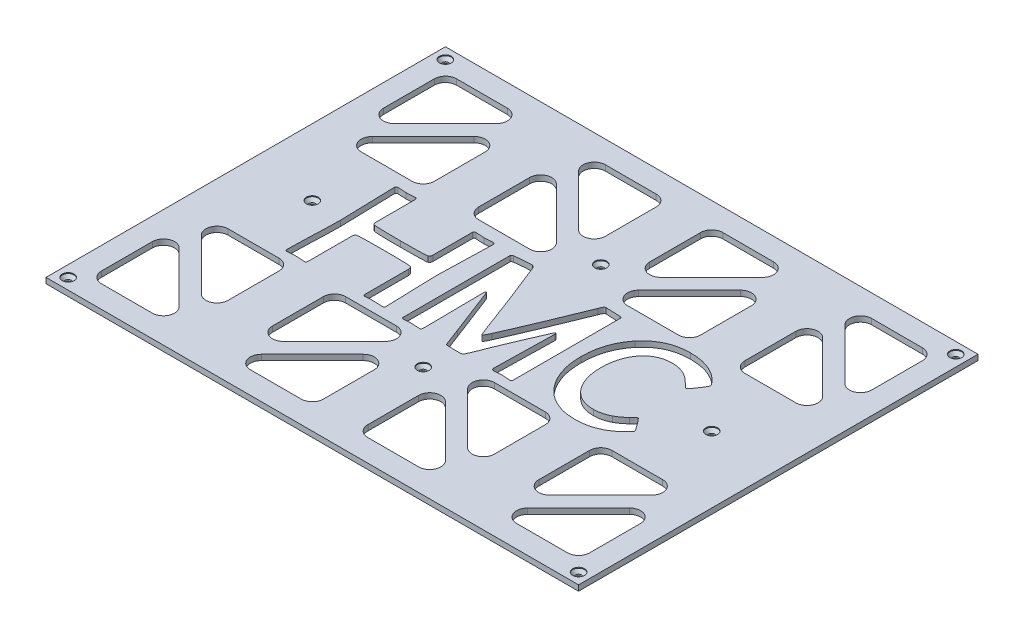
from build123d import *

# Parameters (mm, degrees)
SKETCH2_W                                    = 609.6
SKETCH2_H                                    = 457.2
BOSS_EXTRUDE1_DEPTH                          = 6.35
CSK_FOR_1_4_FLAT_HEAD_SOCKET_CAP_SCR_2_COUNT = 2
CSK_FOR_1_4_FLAT_HEAD_SOCKET_CAP_SCR_2_PITCH = 225.044573363
CSK_FOR_1_4_FLAT_HEAD_SOCKET_CAP_SCR_3_COUNT = 2
CSK_FOR_1_4_FLAT_HEAD_SOCKET_CAP_SCR_3_PITCH = 431.8
CSK_FOR_1_4_FLAT_HEAD_SOCKET_CAP_SCR_4_COUNT = 2
CSK_FOR_1_4_FLAT_HEAD_SOCKET_CAP_SCR_4_PITCH = 431.426308887
CSK_FOR_1_4_FLAT_HEAD_SOCKET_CAP_SCR_5_COUNT = 2
CSK_FOR_1_4_FLAT_HEAD_SOCKET_CAP_SCR_5_PITCH = 313.666861495
CSK_FOR_1_4_FLAT_HEAD_SOCKET_CAP_SCR_6_COUNT = 2
CSK_FOR_1_4_FLAT_HEAD_SOCKET_CAP_SCR_6_PITCH = 584.2
CSK_FOR_1_4_FLAT_HEAD_SOCKET_CAP_SCR_7_COUNT = 2
CSK_FOR_1_4_FLAT_HEAD_SOCKET_CAP_SCR_7_PITCH = 563.685461938
CSK_FOR_1_4_FLAT_HEAD_SOCKET_CAP_SCR_8_COUNT = 2
CSK_FOR_1_4_FLAT_HEAD_SOCKET_CAP_SCR_8_PITCH = 726.457762021


with BuildPart() as part:
    # Sketch2 → Boss-Extrude1 (new body)
    with BuildSketch(Plane(origin=(0, 0, 0), x_dir=(1, 0, 0), z_dir=(0, 1, 0))):
        with Locations((39.071311338, -112.036262161)):
            Rectangle(SKETCH2_W, SKETCH2_H)
        with BuildLine():
            Line((-240.328688662, 78.463737839), (-240.328688662, 20.224250081))
            ThreePointArc((-240.328688662, 20.224250081), (-232.488768253, 8.490980019), (-218.648432541, 11.24399396))
            Line((-218.648432541, 11.24399396), (-160.408944783, 69.483481718))
            ThreePointArc((-160.408944783, 69.483481718), (-157.655930841, 83.32381743), (-169.389200904, 91.163737839))
            Line((-169.389200904, 91.163737839), (-227.628688662, 91.163737839))
            ThreePointArc((-227.628688662, 91.163737839), (-236.608944783, 87.44399396), (-240.328688662, 78.463737839))
        make_face(mode=Mode.SUBTRACT)
        with BuildLine():
            Line((-218.648432541, -14.15600604), (-160.408944783, 44.083481718))
            ThreePointArc((-160.408944783, 44.083481718), (-146.568609071, 46.83649566), (-138.728688662, 35.103225597))
            Line((-138.728688662, 35.103225597), (-138.728688662, -23.136262161))
            ThreePointArc((-138.728688662, -23.136262161), (-142.448432541, -32.116518282), (-151.428688662, -35.836262161))
            Line((-151.428688662, -35.836262161), (-209.668176419, -35.836262161))
            ThreePointArc((-209.668176419, -35.836262161), (-221.401446482, -27.996341752), (-218.648432541, -14.15600604))
        make_face(mode=Mode.SUBTRACT)
        with BuildLine():
            Line((-75.228688662, -35.836262161), (-16.989200904, -35.836262161))
            ThreePointArc((-16.989200904, -35.836262161), (-5.255930841, -27.996341752), (-8.008944783, -14.15600604))
            Line((-8.008944783, -14.15600604), (-66.248432541, 44.083481718))
            ThreePointArc((-66.248432541, 44.083481718), (-80.088768253, 46.83649566), (-87.928688662, 35.103225597))
            Line((-87.928688662, 35.103225597), (-87.928688662, -23.136262161))
            ThreePointArc((-87.928688662, -23.136262161), (-84.208944783, -32.116518282), (-75.228688662, -35.836262161))
        make_face(mode=Mode.SUBTRACT)
        with BuildLine():
            Line((-57.268176419, 91.163737839), (0.971311338, 91.163737839))
            ThreePointArc((0.971311338, 91.163737839), (9.951567459, 87.44399396), (13.671311338, 78.463737839))
            Line((13.671311338, 78.463737839), (13.671311338, 20.224250081))
            ThreePointArc((13.671311338, 20.224250081), (5.831390929, 8.490980019), (-8.008944783, 11.24399396))
            Line((-8.008944783, 11.24399396), (-66.248432541, 69.483481718))
            ThreePointArc((-66.248432541, 69.483481718), (-69.001446482, 83.32381743), (-57.268176419, 91.163737839))
        make_face(mode=Mode.SUBTRACT)
        with BuildLine():
            Line((64.471311338, 78.463737839), (64.471311338, 20.224250081))
            ThreePointArc((64.471311338, 20.224250081), (72.311231747, 8.490980019), (86.151567459, 11.24399396))
            Line((86.151567459, 11.24399396), (144.391055217, 69.483481718))
            ThreePointArc((144.391055217, 69.483481718), (147.144069159, 83.32381743), (135.410799096, 91.163737839))
            Line((135.410799096, 91.163737839), (77.171311338, 91.163737839))
            ThreePointArc((77.171311338, 91.163737839), (68.191055217, 87.44399396), (64.471311338, 78.463737839))
        make_face(mode=Mode.SUBTRACT)
        with BuildLine():
            Line((86.151567459, -14.15600604), (144.391055217, 44.083481718))
            ThreePointArc((144.391055217, 44.083481718), (158.231390929, 46.83649566), (166.071311338, 35.103225597))
            Line((166.071311338, 35.103225597), (166.071311338, -23.136262161))
            ThreePointArc((166.071311338, -23.136262161), (162.351567459, -32.116518282), (153.371311338, -35.836262161))
            Line((153.371311338, -35.836262161), (95.131823581, -35.836262161))
            ThreePointArc((95.131823581, -35.836262161), (83.398553518, -27.996341752), (86.151567459, -14.15600604))
        make_face(mode=Mode.SUBTRACT)
        with BuildLine():
            Line((229.571311338, -35.836262161), (287.810799096, -35.836262161))
            ThreePointArc((287.810799096, -35.836262161), (299.544069159, -27.996341752), (296.791055217, -14.15600604))
            Line((296.791055217, -14.15600604), (238.551567459, 44.083481718))
            ThreePointArc((238.551567459, 44.083481718), (224.711231747, 46.83649566), (216.871311338, 35.103225597))
            Line((216.871311338, 35.103225597), (216.871311338, -23.136262161))
            ThreePointArc((216.871311338, -23.136262161), (220.591055217, -32.116518282), (229.571311338, -35.836262161))
        make_face(mode=Mode.SUBTRACT)
        with BuildLine():
            Line((247.531823581, 91.163737839), (305.771311338, 91.163737839))
            ThreePointArc((305.771311338, 91.163737839), (314.751567459, 87.44399396), (318.471311338, 78.463737839))
            Line((318.471311338, 78.463737839), (318.471311338, 20.224250081))
            ThreePointArc((318.471311338, 20.224250081), (310.631390929, 8.490980019), (296.791055217, 11.24399396))
            Line((296.791055217, 11.24399396), (238.551567459, 69.483481718))
            ThreePointArc((238.551567459, 69.483481718), (235.798553518, 83.32381743), (247.531823581, 91.163737839))
        make_face(mode=Mode.SUBTRACT)
        with BuildLine():
            Line((318.471311338, -302.536262161), (318.471311338, -244.296774403))
            ThreePointArc((318.471311338, -244.296774403), (310.631390929, -232.56350434), (296.791055217, -235.316518282))
            Line((296.791055217, -235.316518282), (238.551567459, -293.55600604))
            ThreePointArc((238.551567459, -293.55600604), (235.798553518, -307.396341752), (247.531823581, -315.236262161))
            Line((247.531823581, -315.236262161), (305.771311338, -315.236262161))
            ThreePointArc((305.771311338, -315.236262161), (314.751567459, -311.516518282), (318.471311338, -302.536262161))
        make_face(mode=Mode.SUBTRACT)
        with BuildLine():
            Line((296.791055217, -209.916518282), (238.551567459, -268.15600604))
            ThreePointArc((238.551567459, -268.15600604), (224.711231747, -270.909019981), (216.871311338, -259.175749919))
            Line((216.871311338, -259.175749919), (216.871311338, -200.936262161))
            ThreePointArc((216.871311338, -200.936262161), (220.591055217, -191.95600604), (229.571311338, -188.236262161))
            Line((229.571311338, -188.236262161), (287.810799096, -188.236262161))
            ThreePointArc((287.810799096, -188.236262161), (299.544069159, -196.07618257), (296.791055217, -209.916518282))
        make_face(mode=Mode.SUBTRACT)
        with BuildLine():
            Line((153.371311338, -188.236262161), (95.131823581, -188.236262161))
            ThreePointArc((95.131823581, -188.236262161), (83.398553518, -196.07618257), (86.151567459, -209.916518282))
            Line((86.151567459, -209.916518282), (144.391055217, -268.15600604))
            ThreePointArc((144.391055217, -268.15600604), (158.231390929, -270.909019981), (166.071311338, -259.175749919))
            Line((166.071311338, -259.175749919), (166.071311338, -200.936262161))
            ThreePointArc((166.071311338, -200.936262161), (162.351567459, -191.95600604), (153.371311338, -188.236262161))
        make_face(mode=Mode.SUBTRACT)
        with BuildLine():
            Line((135.410799096, -315.236262161), (77.171311338, -315.236262161))
            ThreePointArc((77.171311338, -315.236262161), (68.191055217, -311.516518282), (64.471311338, -302.536262161))
            Line((64.471311338, -302.536262161), (64.471311338, -244.296774403))
            ThreePointArc((64.471311338, -244.296774403), (72.311231747, -232.56350434), (86.151567459, -235.316518282))
            Line((86.151567459, -235.316518282), (144.391055217, -293.55600604))
            ThreePointArc((144.391055217, -293.55600604), (147.144069159, -307.396341752), (135.410799096, -315.236262161))
        make_face(mode=Mode.SUBTRACT)
        with BuildLine():
            Line((13.671311338, -302.536262161), (13.671311338, -244.296774403))
            ThreePointArc((13.671311338, -244.296774403), (5.831390929, -232.56350434), (-8.008944783, -235.316518282))
            Line((-8.008944783, -235.316518282), (-66.248432541, -293.55600604))
            ThreePointArc((-66.248432541, -293.55600604), (-69.001446482, -307.396341752), (-57.268176419, -315.236262161))
            Line((-57.268176419, -315.236262161), (0.971311338, -315.236262161))
            ThreePointArc((0.971311338, -315.236262161), (9.951567459, -311.516518282), (13.671311338, -302.536262161))
        make_face(mode=Mode.SUBTRACT)
        with BuildLine():
            Line((-8.008944783, -209.916518282), (-66.248432541, -268.15600604))
            ThreePointArc((-66.248432541, -268.15600604), (-80.088768253, -270.909019981), (-87.928688662, -259.175749919))
            Line((-87.928688662, -259.175749919), (-87.928688662, -200.936262161))
            ThreePointArc((-87.928688662, -200.936262161), (-84.208944783, -191.95600604), (-75.228688662, -188.236262161))
            Line((-75.228688662, -188.236262161), (-16.989200904, -188.236262161))
            ThreePointArc((-16.989200904, -188.236262161), (-5.255930841, -196.07618257), (-8.008944783, -209.916518282))
        make_face(mode=Mode.SUBTRACT)
        with BuildLine():
            Line((-151.428688662, -188.236262161), (-209.668176419, -188.236262161))
            ThreePointArc((-209.668176419, -188.236262161), (-221.401446482, -196.07618257), (-218.648432541, -209.916518282))
            Line((-218.648432541, -209.916518282), (-160.408944783, -268.15600604))
            ThreePointArc((-160.408944783, -268.15600604), (-146.568609071, -270.909019981), (-138.728688662, -259.175749919))
            Line((-138.728688662, -259.175749919), (-138.728688662, -200.936262161))
            ThreePointArc((-138.728688662, -200.936262161), (-142.448432541, -191.95600604), (-151.428688662, -188.236262161))
        make_face(mode=Mode.SUBTRACT)
        with BuildLine():
            Line((-169.389200904, -315.236262161), (-227.628688662, -315.236262161))
            ThreePointArc((-227.628688662, -315.236262161), (-236.608944783, -311.516518282), (-240.328688662, -302.536262161))
            Line((-240.328688662, -302.536262161), (-240.328688662, -244.296774403))
            ThreePointArc((-240.328688662, -244.296774403), (-232.488768253, -232.56350434), (-218.648432541, -235.316518282))
            Line((-218.648432541, -235.316518282), (-160.408944783, -293.55600604))
            ThreePointArc((-160.408944783, -293.55600604), (-157.655930841, -307.396341752), (-169.389200904, -315.236262161))
        make_face(mode=Mode.SUBTRACT)
        with BuildLine():
            add(Edge.make_bspline(
                [(-42.347338313, -174.953657716), (-42.369691549, -175.267395974), (-42.41146811, -175.853749772), (-42.978228428, -176.595151068), (-43.889123051, -176.994018749), (-44.586756035, -177.026953573), (-44.975294394, -177.045296229)],
                knots=[0, 0, 0, 0, 0.97081256, 1.814377484, 2.782743641, 4, 4, 4, 4], degree=3))
            add(Edge.make_bspline(
                [(-44.975294394, -177.045296229), (-45.261377324, -177.037554922), (-45.896411647, -177.02037111), (-46.951127367, -176.96237211), (-48.20259125, -176.881843445), (-50.017298845, -176.751153708), (-52.05975743, -176.543320116), (-53.627469743, -176.519076044), (-54.280404191, -176.508978662)],
                knots=[0, 0, 0, 0, 0.552547447, 1.226520551, 2.039329384, 2.973851592, 4.739643413, 6, 6, 6, 6], degree=3))
            add(Edge.make_bspline(
                [(-54.280404191, -176.508978662), (-54.593190525, -176.519382085), (-55.290204318, -176.542565098), (-56.445823206, -176.544819155), (-57.810054334, -176.687435931), (-59.322058518, -176.772652883), (-60.831909837, -176.883522238), (-62.199650791, -176.962654158), (-63.352716017, -177.020214951), (-64.050280706, -177.03752968), (-64.363174461, -177.045296229)],
                knots=[0, 0, 0, 0, 0.743793217, 1.657470532, 2.744168461, 4.000356907, 5.256545352, 6.341788949, 7.256206783, 8, 8, 8, 8], degree=3))
            add(Edge.make_bspline(
                [(-64.363174461, -177.045296229), (-64.665482377, -177.028465452), (-65.216499921, -176.997787945), (-65.912708595, -176.548572891), (-66.323858123, -175.815537416), (-66.356235592, -175.245842324), (-66.37436534, -174.926841837)],
                knots=[0, 0, 0, 0, 1.076874829, 1.962822975, 2.859283727, 4, 4, 4, 4], degree=3))
            add(Edge.make_bspline(
                [(-66.37436534, -174.926841837), (-66.37436534, -174.193874495), (-66.37436534, -172.647492175), (-66.37436534, -170.198308617), (-66.37436534, -167.4899049), (-66.37436534, -164.5133424), (-66.37436534, -161.277559743), (-66.37436534, -157.782556927), (-66.37436534, -154.037272581), (-66.37436534, -150.113215711), (-66.37436534, -146.189158842), (-66.37436534, -142.434935869), (-66.37436534, -138.939933054), (-66.37436534, -135.713089022), (-66.37436534, -132.736526522), (-66.37436534, -130.028122806), (-66.37436534, -127.570000621), (-66.37436534, -126.023618301), (-66.37436534, -125.290650959)],
                knots=[0, 0, 0, 0, 0.708806051, 1.495407888, 2.368449487, 3.327930848, 4.373851972, 5.497568882, 6.707725554, 7.995678012, 9.292274446, 10.502431118, 11.626148028, 12.672069152, 13.622906537, 14.504592112, 15.291193949, 16, 16, 16, 16], degree=3))
            add(Edge.make_bspline(
                [(-66.37436534, -125.290650959), (-66.397597751, -124.751990495), (-66.439384018, -123.783145281), (-66.779979338, -122.494519655), (-67.461478708, -121.550685593), (-68.099882041, -121.271061926), (-68.412372097, -121.13418981)],
                knots=[0, 0, 0, 0, 1.301191115, 2.340347711, 3.18762198, 4, 4, 4, 4], degree=3))
            add(Edge.make_bspline(
                [(-68.412372097, -121.13418981), (-68.760480585, -121.076732991), (-69.719608709, -120.918424724), (-71.574508678, -120.782346302), (-74.222046782, -120.697723316), (-77.654284422, -120.580382012), (-81.873692073, -120.507113563), (-86.888502649, -120.464331292), (-92.698459991, -120.39354381), (-96.837176493, -120.40439551), (-99.036105205, -120.410161094)],
                knots=[0, 0, 0, 0, 0.276198848, 0.760998629, 1.454531342, 2.350926455, 3.45007523, 4.759088351, 6.278081219, 8, 8, 8, 8], degree=3))
            add(Edge.make_bspline(
                [(-99.036105205, -120.410161094), (-101.226095222, -120.404403114), (-105.346934714, -120.393568494), (-111.130078184, -120.464201638), (-116.135939996, -120.507565579), (-120.355360697, -120.580230009), (-123.787613205, -120.696706623), (-126.435099099, -120.783871393), (-128.298687066, -120.919601667), (-129.275960372, -121.076767001), (-129.633022434, -121.13418981)],
                knots=[0, 0, 0, 0, 1.716442413, 3.229778959, 4.532949346, 5.640079072, 6.53727042, 7.224419056, 7.716629392, 8, 8, 8, 8], degree=3))
            add(Edge.make_bspline(
                [(-129.633022434, -121.13418981), (-129.936828978, -121.271509316), (-130.560043171, -121.553199972), (-131.212081053, -122.500196167), (-131.517077496, -123.787261031), (-131.564273191, -124.752561903), (-131.590581556, -125.290650959)],
                knots=[0, 0, 0, 0, 0.801092324, 1.643322425, 2.686313823, 4, 4, 4, 4], degree=3))
            add(Edge.make_bspline(
                [(-131.590581556, -125.290650959), (-131.590581556, -126.005741049), (-131.590581556, -127.52530749), (-131.590581556, -129.929797918), (-131.590581556, -132.584569878), (-131.590581556, -135.498561995), (-131.590581556, -138.67177427), (-131.590581556, -142.104206702), (-131.590581556, -145.786920666), (-131.590581556, -149.639468527), (-131.590581556, -153.492016387), (-131.590581556, -157.174730351), (-131.590581556, -160.607162783), (-131.590581556, -163.789313684), (-131.590581556, -166.712244427), (-131.590581556, -169.375955013), (-131.590581556, -171.780445441), (-131.590581556, -173.300011882), (-131.590581556, -174.015101972)],
                knots=[0, 0, 0, 0, 0.704457898, 1.496973032, 2.368739681, 3.319757843, 4.367638965, 5.494771602, 6.701155751, 7.995597138, 9.290038525, 10.496422675, 11.623555311, 12.671436434, 13.631260319, 14.503026968, 15.295542102, 16, 16, 16, 16], degree=3))
            add(Edge.make_bspline(
                [(-131.590581556, -174.015101972), (-131.607568816, -174.456905181), (-131.638143082, -175.252078105), (-132.051005328, -176.296043459), (-132.845159217, -176.961793035), (-133.482724291, -177.016613871), (-133.816299461, -177.045296229)],
                knots=[0, 0, 0, 0, 1.241090689, 2.233758587, 3.075899381, 4, 4, 4, 4], degree=3))
            add(Edge.make_bspline(
                [(-133.816299461, -177.045296229), (-134.129190452, -177.037490912), (-134.826748976, -177.020089755), (-135.979872216, -176.963342332), (-137.347327962, -176.880211706), (-138.859124391, -176.787058226), (-140.366555717, -176.636778333), (-141.744560917, -176.565360498), (-142.906494844, -176.507552268), (-143.612990142, -176.489955923), (-143.92588561, -176.482162783)],
                knots=[0, 0, 0, 0, 0.741742135, 1.653638374, 2.735889305, 3.988613689, 5.242949065, 6.325199997, 7.258257865, 8, 8, 8, 8], degree=3))
            add(Edge.make_bspline(
                [(-143.92588561, -176.482162783), (-144.220908817, -176.489905892), (-144.882743472, -176.507276247), (-145.973134015, -176.565696015), (-147.261865457, -176.636903477), (-149.089779069, -176.827111273), (-151.155459642, -176.963984834), (-152.730319911, -177.021243065), (-153.391890678, -177.045296229)],
                knots=[0, 0, 0, 0, 0.560077054, 1.256438124, 2.072310724, 3.009191766, 4.743614697, 6, 6, 6, 6], degree=3))
            add(Edge.make_bspline(
                [(-153.391890678, -177.045296229), (-153.719877841, -177.027332369), (-154.318739324, -176.994532721), (-155.088984308, -176.563951642), (-155.575277898, -175.839807634), (-155.602699935, -175.265755121), (-155.617608583, -174.953657716)],
                knots=[0, 0, 0, 0, 1.122016328, 2.048654451, 2.939104232, 4, 4, 4, 4], degree=3))
            add(Edge.make_bspline(
                [(-155.617608583, -174.953657716), (-155.60747893, -174.068752961), (-155.586094216, -172.200630229), (-155.57744558, -169.241337548), (-155.471419878, -165.979549192), (-155.416307997, -162.402949766), (-155.254561098, -158.515987623), (-155.146937078, -154.304347171), (-154.932431217, -149.783061237), (-154.773582141, -145.053014269), (-154.531889519, -140.326644686), (-154.399530987, -135.801919562), (-154.209725475, -131.584460798), (-154.130319653, -127.685807841), (-153.994137222, -124.102554861), (-153.966277313, -120.839035773), (-153.887681733, -117.88082995), (-153.896985637, -116.012401248), (-153.901392367, -115.127433054)],
                knots=[0, 0, 0, 0, 0.709689674, 1.498226114, 2.373012936, 3.326628284, 4.366637499, 5.492618124, 6.705085512, 7.996339857, 9.287892618, 10.50008451, 11.626316095, 12.673268466, 13.627072386, 14.50171235, 15.290346528, 16, 16, 16, 16], degree=3))
            add(Edge.make_bspline(
                [(-153.901392367, -115.127433054), (-153.897012101, -114.197774318), (-153.887745428, -112.231034421), (-153.96634409, -109.111908021), (-153.994297546, -105.660731981), (-154.129493008, -101.88074151), (-154.210100537, -97.776602499), (-154.399654481, -93.344533892), (-154.532112284, -88.578560417), (-154.773590445, -83.592850476), (-154.932241596, -78.603654003), (-155.146592003, -73.840937329), (-155.255455942, -69.397011375), (-155.416236113, -65.286477552), (-155.470901941, -61.504346626), (-155.577956905, -58.054824261), (-155.585845133, -54.93465632), (-155.607444244, -52.959269705), (-155.617608583, -52.029671229)],
                knots=[0, 0, 0, 0, 0.706875968, 1.495431726, 2.372335173, 3.331081421, 4.371360051, 5.493587194, 6.704119731, 7.99667198, 9.288956141, 10.499736711, 11.621737419, 12.669009151, 13.627586735, 14.497826846, 15.293091356, 16, 16, 16, 16], degree=3))
            add(Edge.make_bspline(
                [(-155.617608583, -52.029671229), (-155.598741514, -51.73770748), (-155.563071774, -51.185726068), (-155.10207165, -50.465440569), (-154.301064476, -50.112183537), (-153.716619752, -50.06918633), (-153.391890678, -50.045296229)],
                knots=[0, 0, 0, 0, 1.022945257, 1.933961902, 2.852068277, 4, 4, 4, 4], degree=3))
            add(Edge.make_bspline(
                [(-153.391890678, -50.045296229), (-153.096984237, -50.05572844), (-152.426808214, -50.079435679), (-151.31573626, -50.080374878), (-149.996382684, -50.224056179), (-148.52907482, -50.310047173), (-147.054899481, -50.419465999), (-145.70509832, -50.499833144), (-144.560917386, -50.556456046), (-143.863355715, -50.573823567), (-143.550463313, -50.581613797)],
                knots=[0, 0, 0, 0, 0.718465081, 1.632714663, 2.702584002, 3.946050271, 5.211225751, 6.301266533, 7.238030389, 8, 8, 8, 8], degree=3))
            add(Edge.make_bspline(
                [(-143.550463313, -50.581613797), (-143.246507652, -50.573830009), (-142.566814365, -50.556424218), (-141.440571385, -50.498823561), (-140.099640218, -50.419796514), (-138.607748436, -50.307885785), (-137.104594331, -50.223909146), (-135.749282943, -50.081974503), (-134.611575734, -50.078800882), (-133.93243807, -50.055652802), (-133.628588313, -50.045296229)],
                knots=[0, 0, 0, 0, 0.734245204, 1.641889262, 2.723135899, 3.978104294, 5.254608515, 6.358881125, 7.265754796, 8, 8, 8, 8], degree=3))
            add(Edge.make_bspline(
                [(-133.628588313, -50.045296229), (-133.33167129, -50.063450448), (-132.798939853, -50.096022925), (-132.081584432, -50.378721067), (-131.656398726, -50.963813932), (-131.613344701, -51.415459079), (-131.590581556, -51.654248932)],
                knots=[0, 0, 0, 0, 1.21187301, 2.174354449, 3.034760729, 4, 4, 4, 4], degree=3))
            add(Edge.make_bspline(
                [(-131.590581556, -51.654248932), (-131.590581556, -52.333584518), (-131.590581556, -53.763764698), (-131.590581556, -56.034175734), (-131.590581556, -58.545929675), (-131.590581556, -61.307965148), (-131.590581556, -64.3024049), (-131.590581556, -67.538187558), (-131.590581556, -71.015313121), (-131.590581556, -74.662272581), (-131.590581556, -78.30923204), (-131.590581556, -81.786357603), (-131.590581556, -85.022140261), (-131.590581556, -88.016580013), (-131.590581556, -90.778615486), (-131.590581556, -93.299308054), (-131.590581556, -95.578657716), (-131.590581556, -97.017776522), (-131.590581556, -97.697112108)],
                knots=[0, 0, 0, 0, 0.708211998, 1.490972627, 2.366919045, 3.326732673, 4.370413512, 5.488642982, 6.700058241, 7.995340711, 9.29062318, 10.502038439, 11.620267909, 12.663948748, 13.623762376, 14.499708794, 15.291788002, 16, 16, 16, 16], degree=3))
            add(Edge.make_bspline(
                [(-131.590581556, -97.697112108), (-131.576709688, -98.075898771), (-131.551176029, -98.773123515), (-131.203778367, -99.702058875), (-130.590922257, -100.394505112), (-130.048407536, -100.613666438), (-129.767101826, -100.727306364)],
                knots=[0, 0, 0, 0, 1.18557836, 2.182269466, 3.057467089, 4, 4, 4, 4], degree=3))
            add(Edge.make_bspline(
                [(-129.767101826, -100.727306364), (-129.446173901, -100.795753123), (-128.536597997, -100.989745348), (-126.736858015, -101.091076217), (-124.129033478, -101.237240816), (-120.694182497, -101.321151368), (-116.431554255, -101.449330298), (-111.344455329, -101.4726973), (-105.436364633, -101.550027287), (-101.22611097, -101.538125278), (-98.982473448, -101.531782716)],
                knots=[0, 0, 0, 0, 0.255301972, 0.723578425, 1.399725174, 2.291212045, 3.39841577, 4.721144201, 6.252702927, 8, 8, 8, 8], degree=3))
            add(Edge.make_bspline(
                [(-98.982473448, -101.531782716), (-96.783530091, -101.538091117), (-92.653724438, -101.549938839), (-86.852883036, -101.472808977), (-81.837341187, -101.448720172), (-77.610347946, -101.321239314), (-74.175839236, -101.235736312), (-71.540518327, -101.092231132), (-69.689144864, -100.983415919), (-68.733367744, -100.795639159), (-68.385556218, -100.727306364)],
                knots=[0, 0, 0, 0, 1.723074995, 3.236083746, 4.545975828, 5.653020866, 6.55001788, 7.237338963, 7.722464272, 8, 8, 8, 8], degree=3))
            add(Edge.make_bspline(
                [(-68.385556218, -100.727306364), (-68.070606375, -100.611993594), (-67.431020763, -100.37782174), (-66.805273976, -99.457927533), (-66.43268613, -98.281781662), (-66.395182018, -97.38846929), (-66.37436534, -96.892635756)],
                knots=[0, 0, 0, 0, 0.843206921, 1.712345715, 2.730236204, 4, 4, 4, 4], degree=3))
            add(Edge.make_bspline(
                [(-66.37436534, -96.892635756), (-66.37436534, -96.231177423), (-66.37436534, -94.827813121), (-66.37436534, -92.602095216), (-66.37436534, -90.135034405), (-66.37436534, -87.435569315), (-66.37436534, -84.503699945), (-66.37436534, -81.339426297), (-66.37436534, -77.933809743), (-66.37436534, -74.367297918), (-66.37436534, -70.800786094), (-66.37436534, -67.386230914), (-66.37436534, -64.213018639), (-66.37436534, -61.272210644), (-66.37436534, -58.572745554), (-66.37436534, -56.105684743), (-66.37436534, -53.879966837), (-66.37436534, -52.476602536), (-66.37436534, -51.815144202)],
                knots=[0, 0, 0, 0, 0.704342653, 1.494348602, 2.370017847, 3.331350387, 4.368828079, 5.491969066, 6.700773349, 7.995240928, 9.289708507, 10.49851279, 11.631171921, 12.668649613, 13.629982153, 14.505651398, 15.295657347, 16, 16, 16, 16], degree=3))
            add(Edge.make_bspline(
                [(-66.37436534, -51.815144202), (-66.352484071, -51.550415112), (-66.311836302, -51.058640763), (-65.899155937, -50.410507641), (-65.163258131, -50.08513521), (-64.616215952, -50.059607262), (-64.309542705, -50.045296229)],
                knots=[0, 0, 0, 0, 1.017086362, 1.889391842, 2.816787659, 4, 4, 4, 4], degree=3))
            add(Edge.make_bspline(
                [(-64.309542705, -50.045296229), (-63.611926439, -50.055288453), (-61.954968017, -50.0790217), (-59.341185683, -50.327995653), (-56.722484511, -50.501408132), (-55.058219546, -50.557929825), (-54.360851826, -50.581613797)],
                knots=[0, 0, 0, 0, 0.839869077, 1.994833275, 3.159786106, 4, 4, 4, 4], degree=3))
            add(Edge.make_bspline(
                [(-54.360851826, -50.581613797), (-54.056891302, -50.573935482), (-53.386112929, -50.556991019), (-52.277784701, -50.498509787), (-50.972521491, -50.420745888), (-49.525428535, -50.307657874), (-48.075805369, -50.224309679), (-46.765373157, -50.081454767), (-45.654360879, -50.078607126), (-44.984164507, -50.055687312), (-44.680319732, -50.045296229)],
                knots=[0, 0, 0, 0, 0.752479509, 1.660567539, 2.74658428, 3.98858287, 5.252648408, 6.340241208, 7.247520491, 8, 8, 8, 8], degree=3))
            add(Edge.make_bspline(
                [(-44.680319732, -50.045296229), (-44.33749799, -50.068350427), (-43.726638706, -50.109429708), (-42.895691805, -50.463073519), (-42.396328471, -51.176862047), (-42.36418458, -51.736415365), (-42.347338313, -52.029671229)],
                knots=[0, 0, 0, 0, 1.178462696, 2.09985188, 3.004152848, 4, 4, 4, 4], degree=3))
            add(Edge.make_bspline(
                [(-42.347338313, -52.029671229), (-42.343024246, -52.959328978), (-42.333856146, -54.935004485), (-42.411684518, -58.054144436), (-42.440694249, -61.505303476), (-42.575913081, -65.285288502), (-42.655445174, -69.398395463), (-42.845666588, -73.839384557), (-42.97803661, -78.605360318), (-43.219550159, -83.591069267), (-43.378155831, -88.580267207), (-43.592640406, -93.342979413), (-43.700842793, -97.777988681), (-43.862558305, -101.879551448), (-43.91718425, -105.661689371), (-44.023334901, -109.111229298), (-44.032003749, -112.231384057), (-44.053427085, -114.197834061), (-44.063554529, -115.127433054)],
                knots=[0, 0, 0, 0, 0.706875989, 1.502227654, 2.372335066, 3.331081343, 4.378154583, 5.50038176, 6.710914333, 8.003466621, 9.295750821, 10.506531428, 11.628532169, 12.669010652, 13.627588265, 14.504623435, 15.293091335, 16, 16, 16, 16], degree=3))
            add(Edge.make_bspline(
                [(-44.063554529, -115.127433054), (-44.053426158, -116.012337852), (-44.032044149, -117.880460673), (-44.023372656, -120.839752591), (-43.917448027, -124.101544324), (-43.861765702, -127.68706201), (-43.701125094, -131.58300169), (-43.592766058, -135.803555455), (-43.378413248, -140.324846639), (-43.219512432, -145.054891889), (-42.97786008, -149.78126263), (-42.845401366, -154.305985086), (-42.656323372, -158.514525755), (-42.57570741, -162.404206334), (-42.44013462, -165.97853734), (-42.412211446, -169.242054667), (-42.333630175, -172.200260889), (-42.342932386, -174.068689544), (-42.347338313, -174.953657716)],
                knots=[0, 0, 0, 0, 0.709689742, 1.498226256, 2.373013161, 3.326628601, 4.373801903, 5.499782635, 6.712250138, 8.003504606, 9.29505749, 10.507249497, 11.63348119, 12.67326815, 13.62707216, 14.501712208, 15.290346461, 16, 16, 16, 16], degree=3))
        make_face(mode=Mode.SUBTRACT)
        with BuildLine():
            add(Edge.make_bspline(
                [(103.531040066, -174.792762445), (103.514225689, -175.129569324), (103.483893334, -175.737153321), (103.048077213, -176.527008821), (102.294604295, -177.001121906), (101.705835625, -177.029739281), (101.385769795, -177.045296229)],
                knots=[0, 0, 0, 0, 1.128070766, 2.034987371, 2.931781821, 4, 4, 4, 4], degree=3))
            add(Edge.make_bspline(
                [(101.385769795, -177.045296229), (101.099693627, -177.037421826), (100.455750232, -177.019696933), (99.391991492, -176.963640516), (98.122819349, -176.880419533), (96.307758802, -176.754548979), (94.274549373, -176.543176992), (92.724666002, -176.519017422), (92.080659998, -176.508978662)],
                knots=[0, 0, 0, 0, 0.552548226, 1.243758903, 2.056568883, 3.008304815, 4.756893779, 6, 6, 6, 6], degree=3))
            add(Edge.make_bspline(
                [(92.080659998, -176.508978662), (91.785754046, -176.51935311), (91.133438706, -176.542300805), (90.049206184, -176.545408465), (88.774475539, -176.68652486), (86.940732879, -176.799394121), (84.887249528, -176.96890758), (83.321044616, -177.022824786), (82.668286687, -177.045296229)],
                knots=[0, 0, 0, 0, 0.563333031, 1.246060904, 2.067917339, 3.00885354, 4.753359441, 6, 6, 6, 6], degree=3))
            add(Edge.make_bspline(
                [(82.668286687, -177.045296229), (82.344468496, -177.014705019), (81.717440587, -176.955469487), (80.942949001, -176.311254771), (80.544822534, -175.294416652), (80.513753365, -174.528347675), (80.496200539, -174.095549608)],
                knots=[0, 0, 0, 0, 0.92387763, 1.788957734, 2.750850318, 4, 4, 4, 4], degree=3))
            add(Edge.make_bspline(
                [(80.496200539, -174.095549608), (80.491881303, -173.085448523), (80.482783539, -170.957835968), (80.55943767, -167.588347099), (80.596606113, -163.860562378), (80.693338079, -159.776053969), (80.752045725, -155.332681491), (80.910013635, -150.542563129), (81.028123331, -145.393259521), (81.197368122, -140.012676376), (81.343635962, -134.622271), (81.525702289, -129.47468786), (81.613872225, -124.673670782), (81.730985711, -120.240571657), (81.815002762, -116.146648547), (81.854459109, -112.418920428), (81.930762349, -109.040482198), (81.921730185, -106.912871225), (81.917442093, -105.902770891)],
                knots=[0, 0, 0, 0, 0.710791345, 1.497165594, 2.371592352, 3.334176241, 4.372228945, 5.498611931, 6.706737647, 7.996778562, 9.286819476, 10.501412441, 11.621348734, 12.665823189, 13.622118105, 14.502834406, 15.289208655, 16, 16, 16, 16], degree=3))
            add(Edge.make_bspline(
                [(81.917442093, -105.902770891), (81.903124942, -105.652178757), (81.878904851, -105.228256117), (81.806814992, -104.673937812), (81.563409152, -104.297076508), (81.324808283, -104.238878713), (81.220229255, -104.213370554)],
                knots=[0, 0, 0, 0, 1.513432116, 2.560248502, 3.368955304, 4, 4, 4, 4], degree=3))
            add(Edge.make_bspline(
                [(81.220229255, -104.213370554), (80.958995494, -104.266221101), (80.376503078, -104.384065912), (80.090696392, -104.913540186), (79.933067093, -105.205558054)],
                knots=[0, 0, 0, 0, 0.896951629, 2, 2, 2, 2], degree=3))
            add(Edge.make_bspline(
                [(79.933067093, -105.205558054), (79.715793594, -105.651213127), (79.240764926, -106.625556236), (78.533351534, -108.237443748), (77.69035866, -110.091378722), (76.763844084, -112.206260869), (75.701010749, -114.56366852), (74.601136497, -117.201920348), (73.307457448, -120.054253944), (72.029510828, -123.20964155), (70.549901122, -126.576394572), (69.052507739, -130.235162277), (67.355032454, -134.106401298), (65.674263113, -138.280029319), (63.795518965, -142.66742736), (61.884560856, -147.336430616), (59.835544492, -152.248096487), (58.443801132, -155.610134407), (57.729519795, -157.335625621)],
                knots=[0, 0, 0, 0, 0.419936897, 0.918115032, 1.490864634, 2.145101273, 2.873910029, 3.681206217, 4.566086307, 5.526523327, 6.564475569, 7.681006029, 8.875049204, 10.144764203, 11.491944577, 12.917749911, 14.418103669, 16, 16, 16, 16], degree=3))
            add(Edge.make_bspline(
                [(57.729519795, -157.335625621), (57.20993495, -158.777692217), (56.104020585, -161.847069964), (54.177514297, -166.662866104), (51.98813877, -172.007475494), (50.371678476, -175.716640833), (49.523861012, -177.662061432)],
                knots=[0, 0, 0, 0, 0.838892904, 1.785548059, 2.838541821, 4, 4, 4, 4], degree=3))
            add(Edge.make_bspline(
                [(49.523861012, -177.662061432), (49.430681117, -177.759160226), (49.208283958, -177.990910822), (48.662465716, -178.16670162), (47.968995742, -178.357189396), (47.070679221, -178.518104839), (45.96776387, -178.610156419), (44.662113367, -178.690370271), (43.151007026, -178.742520786), (42.078030116, -178.754907687), (41.505913376, -178.761512445)],
                knots=[0, 0, 0, 0, 0.388302156, 0.926780362, 1.630083683, 2.506176111, 3.582181847, 4.864459833, 6.328114053, 8, 8, 8, 8], degree=3))
            add(Edge.make_bspline(
                [(41.505913376, -178.761512445), (40.683492829, -178.767254922), (39.136763934, -178.778054816), (36.96502277, -178.707629596), (35.078523928, -178.663152248), (33.485954596, -178.593405854), (32.182610695, -178.47046221), (31.174485495, -178.394213923), (30.453795074, -178.239936004), (30.090210528, -178.094328017), (29.948269795, -178.037483729)],
                knots=[0, 0, 0, 0, 1.69868681, 3.194725595, 4.487732124, 5.596955283, 6.48629867, 7.191806625, 7.684487251, 8, 8, 8, 8], degree=3))
            add(Edge.make_bspline(
                [(29.948269795, -178.037483729), (29.706016432, -177.394244663), (29.201597432, -176.054894813), (28.425636954, -173.937998672), (27.538859615, -171.657179903), (26.594789184, -169.183245019), (25.616815909, -166.516298372), (24.50009922, -163.687211714), (23.358318298, -160.649275598), (22.557483255, -158.568599271), (22.144849187, -157.496520891)],
                knots=[0, 0, 0, 0, 0.750736115, 1.563179782, 2.462489513, 3.423488316, 4.455322605, 5.564916858, 6.745311822, 8, 8, 8, 8], degree=3))
            add(Edge.make_bspline(
                [(22.144849187, -157.496520891), (21.556870088, -155.913643818), (20.309871035, -152.556643182), (18.294750771, -147.260857044), (16.070168478, -141.40220627), (13.608313104, -135.012472143), (10.907954102, -128.07442679), (8.031885666, -120.572625693), (4.884311872, -112.535244033), (2.720702399, -106.993480798), (1.603886349, -104.132922918)],
                knots=[0, 0, 0, 0, 0.708716434, 1.503061457, 2.378208417, 3.339006028, 4.377112648, 5.503026776, 6.711107615, 8, 8, 8, 8], degree=3))
            add(Edge.make_bspline(
                [(1.603886349, -104.132922918), (1.489344871, -103.91882802), (1.227380378, -103.429177789), (0.799091013, -103.073012208), (0.558067093, -102.872576635)],
                knots=[0, 0, 0, 0, 0.874480946, 2, 2, 2, 2], degree=3))
            add(Edge.make_bspline(
                [(0.558067093, -102.872576635), (0.362059148, -103.112597444), (-0.103474311, -103.682664733), (-0.12606603, -104.426373555), (-0.139145745, -104.856951635)],
                knots=[0, 0, 0, 0, 0.842078872, 2, 2, 2, 2], degree=3))
            add(Edge.make_bspline(
                [(-0.139145745, -104.856951635), (-0.141346001, -105.884903177), (-0.146014445, -108.065982834), (-0.106389696, -111.516186868), (-0.094582263, -115.333195344), (-0.016405723, -119.50712518), (-0.02160266, -124.048560352), (0.083712513, -128.955383788), (0.15909692, -134.229218), (0.22753166, -139.744708892), (0.347173392, -145.250379573), (0.427112446, -150.515302689), (0.475045641, -155.413851489), (0.526684903, -159.954692587), (0.591400184, -164.128832332), (0.606347523, -167.945810352), (0.645259951, -171.396021295), (0.640675431, -173.577100138), (0.638514728, -174.605051297)],
                knots=[0, 0, 0, 0, 0.707366902, 1.500871876, 2.374337883, 3.333975319, 4.373515313, 5.499302584, 6.711193339, 8.003038614, 9.29498639, 10.500726846, 11.626430095, 12.666024681, 13.625662117, 14.499128124, 15.292633098, 16, 16, 16, 16], degree=3))
            add(Edge.make_bspline(
                [(0.638514728, -174.605051297), (0.622474997, -175.0475078), (0.594333508, -175.823791736), (0.190982483, -176.836573758), (-0.558432132, -177.498344909), (-1.181400279, -177.553045514), (-1.506755542, -177.581613797)],
                knots=[0, 0, 0, 0, 1.273061421, 2.233569006, 3.077452634, 4, 4, 4, 4], degree=3))
            add(Edge.make_bspline(
                [(-1.506755542, -177.581613797), (-2.114735161, -177.557543114), (-3.600299441, -177.498727743), (-5.959768203, -177.326901523), (-8.32297218, -177.081452325), (-9.819266037, -177.055854554), (-10.436443042, -177.045296229)],
                knots=[0, 0, 0, 0, 0.81596766, 1.993771456, 3.172490003, 4, 4, 4, 4], degree=3))
            add(Edge.make_bspline(
                [(-10.436443042, -177.045296229), (-11.071492668, -177.055767874), (-12.603480229, -177.081029567), (-15.011592056, -177.325105678), (-17.433342748, -177.50215045), (-18.963713432, -177.558084703), (-19.607473448, -177.581613797)],
                knots=[0, 0, 0, 0, 0.829145214, 2.000221877, 3.158780805, 4, 4, 4, 4], degree=3))
            add(Edge.make_bspline(
                [(-19.607473448, -177.581613797), (-19.923675065, -177.567346405), (-20.488786121, -177.541847924), (-21.233452253, -177.218576037), (-21.697220055, -176.608649705), (-21.733457658, -176.123565072), (-21.752743718, -175.865397581)],
                knots=[0, 0, 0, 0, 1.210561661, 2.163498672, 3.022593359, 4, 4, 4, 4], degree=3))
            add(Edge.make_bspline(
                [(-21.752743718, -175.865397581), (-21.752743718, -174.980473594), (-21.752743718, -173.103362108), (-21.752743718, -170.135738234), (-21.752743718, -166.855262445), (-21.752743718, -163.270873369), (-21.752743718, -159.373632378), (-21.752743718, -155.163539472), (-21.752743718, -150.640594653), (-21.752743718, -145.912061432), (-21.752743718, -141.183528211), (-21.752743718, -136.660583391), (-21.752743718, -132.44155186), (-21.752743718, -128.535372243), (-21.752743718, -124.94204454), (-21.752743718, -121.661568752), (-21.752743718, -118.693944878), (-21.752743718, -116.816833391), (-21.752743718, -115.931909405)],
                knots=[0, 0, 0, 0, 0.708724832, 1.503355705, 2.376733781, 3.336017897, 4.374049217, 5.497986577, 6.707829978, 7.996420582, 9.285011186, 10.494854586, 11.618791946, 12.663982103, 13.623266219, 14.496644295, 15.291275168, 16, 16, 16, 16], degree=3))
            add(Edge.make_bspline(
                [(-21.752743718, -115.931909405), (-21.752743718, -115.011230914), (-21.752743718, -113.071549045), (-21.752743718, -109.996661657), (-21.752743718, -106.599983729), (-21.752743718, -102.872576635), (-21.752743718, -98.814440373), (-21.752743718, -94.434513572), (-21.752743718, -89.723857603), (-21.752743718, -84.798674608), (-21.752743718, -79.873491612), (-21.752743718, -75.162835644), (-21.752743718, -70.782908842), (-21.752743718, -66.724772581), (-21.752743718, -62.997365486), (-21.752743718, -59.591748932), (-21.752743718, -56.507922918), (-21.752743718, -54.559302423), (-21.752743718, -53.638623932)],
                knots=[0, 0, 0, 0, 0.709427464, 1.494619027, 2.369349978, 3.326732673, 4.366767111, 5.496340938, 6.701678864, 7.996556177, 9.291433491, 10.496771416, 11.626345243, 12.666379681, 13.623762376, 14.498493328, 15.290572536, 16, 16, 16, 16], degree=3))
            add(Edge.make_bspline(
                [(-21.752743718, -53.638623932), (-21.732178765, -53.380461571), (-21.691945397, -52.875391572), (-21.203507256, -52.237180751), (-20.441294145, -51.820601659), (-19.837161262, -51.731025405), (-19.500209934, -51.68106481)],
                knots=[0, 0, 0, 0, 0.92109772, 1.802039699, 2.774101421, 4, 4, 4, 4], degree=3))
            add(Edge.make_bspline(
                [(-19.500209934, -51.68106481), (-18.427452132, -51.557172337), (-16.344701414, -51.316636088), (-13.327403406, -50.947473558), (-10.507488471, -50.703187455), (-7.901125608, -50.433807674), (-5.493387263, -50.294448405), (-3.295732285, -50.148090911), (-1.301842444, -50.063428555), (-0.040887095, -50.051135455), (0.558067093, -50.045296229)],
                knots=[0, 0, 0, 0, 1.287186291, 2.499061919, 3.622824296, 4.660729249, 5.621743766, 6.497018098, 7.286083123, 8, 8, 8, 8], degree=3))
            add(Edge.make_bspline(
                [(0.558067093, -50.045296229), (0.739676696, -50.081609766), (1.161735027, -50.166001946), (1.816247002, -50.54915608), (2.531015994, -51.190463268), (3.020666083, -51.712309194), (3.293286687, -52.002855351)],
                knots=[0, 0, 0, 0, 0.644578438, 1.497991813, 2.606966489, 4, 4, 4, 4], degree=3))
            add(Edge.make_bspline(
                [(3.293286687, -52.002855351), (4.895370476, -56.015474801), (8.055232601, -63.929745152), (12.692853422, -75.648938619), (17.169458355, -87.033927819), (21.474443495, -98.094535544), (25.560357713, -108.839834712), (29.508532317, -119.250971487), (33.298352119, -129.327282196), (35.727085202, -135.952777538), (36.920398174, -139.208091837)],
                knots=[0, 0, 0, 0, 1.109420449, 2.188159997, 3.23622524, 4.250652117, 5.235745292, 6.188054551, 7.109734197, 8, 8, 8, 8], degree=3))
            add(Edge.make_bspline(
                [(36.920398174, -139.208091837), (37.174368932, -139.916286045), (37.649142389, -141.240185749), (38.38594982, -143.05155776), (38.996135324, -144.59660768), (39.538923343, -145.851195693), (39.966717, -146.856643643), (40.374846613, -147.526053358), (40.584454113, -148.031520018), (40.812974659, -148.151438325), (40.889148174, -148.191411094)],
                knots=[0, 0, 0, 0, 1.827398573, 3.41614264, 4.750850743, 5.860006045, 6.744200085, 7.385429686, 7.795143229, 8, 8, 8, 8], degree=3))
            add(Edge.make_bspline(
                [(40.889148174, -148.191411094), (40.982389558, -148.161736822), (41.234792458, -148.081409052), (41.546208077, -147.683924051), (41.974196183, -147.139516343), (42.420838524, -146.332230245), (43.006505089, -145.341390714), (43.606465847, -144.10556547), (44.274843553, -142.652745082), (44.742514869, -141.613001713), (44.991977566, -141.058387445)],
                knots=[0, 0, 0, 0, 0.27736226, 0.750815097, 1.394626081, 2.295593491, 3.391207711, 4.715644425, 6.248076863, 8, 8, 8, 8], degree=3))
            add(Edge.make_bspline(
                [(44.991977566, -141.058387445), (45.547013435, -139.816292576), (46.688188449, -137.262497934), (48.430176124, -133.32007468), (50.253175549, -129.163386733), (52.161839303, -124.785496212), (54.140672707, -120.192418998), (56.176613532, -115.36601047), (58.332276262, -110.34550436), (60.513516879, -105.074619712), (62.835448977, -99.618294016), (65.191911205, -93.919188061), (67.621380852, -88.006328933), (70.15521645, -81.879829035), (72.748504394, -75.530172165), (75.431224256, -68.960744685), (78.193105226, -62.176259696), (80.058598355, -57.580716633), (81.005702228, -55.247576635)],
                knots=[0, 0, 0, 0, 0.701671456, 1.442663398, 2.222982774, 3.042635534, 3.905859746, 4.802382248, 5.744303701, 6.723790156, 7.744421426, 8.802635453, 9.904477547, 11.041426237, 12.222009824, 13.441965961, 14.701295701, 16, 16, 16, 16], degree=3))
            add(Edge.make_bspline(
                [(81.005702228, -55.247576635), (81.272663944, -54.4775837), (81.743480426, -53.119616084), (82.595651513, -51.461107777), (83.529400909, -50.306623637), (84.314649621, -50.123934974), (84.652661687, -50.045296229)],
                knots=[0, 0, 0, 0, 1.46292682, 2.580033088, 3.388772063, 4, 4, 4, 4], degree=3))
            add(Edge.make_bspline(
                [(84.652661687, -50.045296229), (85.18003222, -50.053741219), (86.342195655, -50.072351393), (88.265536958, -50.115048123), (90.534183565, -50.271795216), (93.046214713, -50.417241725), (95.565634195, -50.583181541), (97.845335146, -50.690852019), (99.776600575, -50.743845653), (100.938821025, -50.761371848), (101.466217431, -50.769324945)],
                knots=[0, 0, 0, 0, 0.752083313, 1.657361707, 2.742588663, 3.99397119, 5.245353717, 6.342638293, 7.247916687, 8, 8, 8, 8], degree=3))
            add(Edge.make_bspline(
                [(101.466217431, -50.769324945), (101.775847622, -50.787181893), (102.340474544, -50.819744975), (103.087253538, -51.261522571), (103.466819725, -52.044461503), (103.508389182, -52.625051813), (103.531040066, -52.941411094)],
                knots=[0, 0, 0, 0, 1.077694319, 1.965232209, 2.891270377, 4, 4, 4, 4], degree=3))
            add(Edge.make_bspline(
                [(103.531040066, -52.941411094), (103.531040066, -53.862089585), (103.531040066, -55.810710081), (103.531040066, -58.894536094), (103.531040066, -62.300152648), (103.531040066, -66.036498369), (103.531040066, -70.09463463), (103.531040066, -74.483500058), (103.531040066, -79.194156027), (103.531040066, -84.128277648), (103.531040066, -89.06239927), (103.531040066, -93.773055238), (103.531040066, -98.161920666), (103.531040066, -102.220056927), (103.531040066, -105.956402648), (103.531040066, -109.362019202), (103.531040066, -112.445845216), (103.531040066, -114.394465711), (103.531040066, -115.315144202)],
                knots=[0, 0, 0, 0, 0.708512468, 1.499570077, 2.373172829, 3.329320722, 4.374892519, 5.496130696, 6.706792777, 8, 9.293207223, 10.503869304, 11.625107481, 12.670679278, 13.626827171, 14.500429923, 15.291487532, 16, 16, 16, 16], degree=3))
            add(Edge.make_bspline(
                [(103.531040066, -115.315144202), (103.531040066, -116.191129563), (103.531040066, -118.050363797), (103.531040066, -121.000110418), (103.531040066, -124.262708954), (103.531040066, -127.829220779), (103.531040066, -131.708584518), (103.531040066, -135.900800171), (103.531040066, -140.405867738), (103.531040066, -145.107585081), (103.531040066, -149.809302423), (103.531040066, -154.305431364), (103.531040066, -158.488708391), (103.531040066, -162.350194878), (103.531040066, -165.89882945), (103.531040066, -169.134612108), (103.531040066, -172.066481477), (103.531040066, -173.916777085), (103.531040066, -174.792762445)],
                knots=[0, 0, 0, 0, 0.706943192, 1.500450857, 2.380522994, 3.339945897, 4.378719567, 5.511271416, 6.723174031, 8.014427412, 9.305680794, 10.517583408, 11.642921551, 12.681695221, 13.633904418, 14.506762849, 15.293056808, 16, 16, 16, 16], degree=3))
        make_face(mode=Mode.SUBTRACT)
        with BuildLine():
            add(Edge.make_bspline(
                [(223.666175201, -155.780304675), (223.641304224, -155.980216514), (223.585589225, -156.428051276), (223.201897922, -157.124821305), (222.65512656, -157.930699239), (222.179969843, -158.484401631), (221.923143106, -158.783683054)],
                knots=[0, 0, 0, 0, 0.679757933, 1.5227674, 2.661032156, 4, 4, 4, 4], degree=3))
            add(Edge.make_bspline(
                [(221.923143106, -158.783683054), (220.436606728, -160.381897765), (217.518544114, -163.519184326), (212.640153428, -167.57690254), (207.525511641, -171.039123332), (202.135196555, -173.879236116), (196.461115592, -176.060051347), (190.53435775, -177.609158737), (184.341311979, -178.580841495), (180.120805828, -178.700558208), (177.971918444, -178.761512445)],
                knots=[0, 0, 0, 0, 1.050233005, 2.061601529, 3.047766163, 4.020127019, 4.989013374, 5.968390316, 6.965597902, 8, 8, 8, 8], degree=3))
            add(Edge.make_bspline(
                [(177.971918444, -178.761512445), (175.752133568, -178.697258539), (171.400657623, -178.571300689), (165.040221888, -177.655146001), (159.022521064, -176.099516157), (153.35915244, -173.911991157), (148.017927297, -171.136132003), (143.044888178, -167.699096015), (138.380500494, -163.668272755), (135.64812867, -160.552154896), (134.262036687, -158.971394202)],
                knots=[0, 0, 0, 0, 1.072462952, 2.102364418, 3.097635614, 4.069844714, 5.030052859, 5.999311743, 6.985080314, 8, 8, 8, 8], degree=3))
            add(Edge.make_bspline(
                [(134.262036687, -158.971394202), (133.02946839, -157.413898565), (130.573317771, -154.310262132), (127.507894645, -149.209663638), (124.860813311, -143.870332722), (122.719444822, -138.225864519), (121.00919019, -132.311636164), (119.860308989, -126.085769974), (119.106841962, -119.588441827), (119.020772534, -115.156432822), (118.976986012, -112.901715148)],
                knots=[0, 0, 0, 0, 0.961228712, 1.915449636, 2.875897892, 3.844857895, 4.835704658, 5.85387429, 6.908190944, 8, 8, 8, 8], degree=3))
            add(Edge.make_bspline(
                [(118.976986012, -112.901715148), (119.021520806, -110.64713482), (119.109061084, -106.21539579), (119.852100537, -99.714436112), (121.041953467, -93.483103932), (122.771196365, -87.549184972), (124.945672055, -81.881389022), (127.604801355, -76.495210477), (130.776327528, -71.398045204), (133.240598835, -68.25003674), (134.476563714, -66.671140824)],
                knots=[0, 0, 0, 0, 1.086701115, 2.136085232, 3.150306645, 4.141851665, 5.111847018, 6.073574013, 7.033793537, 8, 8, 8, 8], degree=3))
            add(Edge.make_bspline(
                [(134.476563714, -66.671140824), (135.872358149, -65.073452579), (138.61933065, -61.929145962), (143.281031687, -57.846187004), (148.233942661, -54.339633973), (153.560471, -51.522009935), (159.203883883, -49.293470949), (165.195625469, -47.759811267), (171.504708835, -46.792703028), (175.823053388, -46.673606776), (178.025550201, -46.612863797)],
                knots=[0, 0, 0, 0, 1.024564223, 2.016378399, 2.9873516, 3.951929547, 4.922017841, 5.91345546, 6.935794112, 8, 8, 8, 8], degree=3))
            add(Edge.make_bspline(
                [(178.025550201, -46.612863797), (180.254111395, -46.668388869), (184.594415788, -46.77652847), (190.902024557, -47.647960975), (196.823450974, -49.071418273), (202.374498288, -51.034315291), (207.518965593, -53.650146951), (212.284722733, -56.797055899), (216.694222516, -60.507864899), (219.223918041, -63.408896976), (220.501901552, -64.874476972)],
                knots=[0, 0, 0, 0, 1.11720067, 2.175839276, 3.185817602, 4.166956791, 5.121145464, 6.072191569, 7.026085407, 8, 8, 8, 8], degree=3))
            add(Edge.make_bspline(
                [(220.501901552, -64.874476972), (220.723528864, -65.164722428), (221.13244294, -65.700240599), (221.601696169, -66.514617714), (221.897010664, -67.267825162), (221.933312831, -67.759612533), (221.949958985, -67.985118864)],
                knots=[0, 0, 0, 0, 1.253613079, 2.312982233, 3.226427496, 4, 4, 4, 4], degree=3))
            add(Edge.make_bspline(
                [(221.949958985, -67.985118864), (221.927835388, -68.138218544), (221.871659217, -68.526968797), (221.609278965, -69.181667091), (221.19358622, -70.010980192), (220.656686077, -71.049904948), (219.930145637, -72.254448106), (219.073786103, -73.670628707), (218.014906608, -75.233088707), (216.890667469, -76.94469655), (215.732271794, -78.613151436), (214.650770763, -80.117279585), (213.725439881, -81.412898429), (212.897206712, -82.454449233), (212.194046679, -83.267683281), (211.640156703, -83.860361637), (211.20162856, -84.25986513), (210.904815454, -84.339891783), (210.794553579, -84.369620554)],
                knots=[0, 0, 0, 0, 0.369789192, 0.938967621, 1.676682302, 2.596552482, 3.739134059, 5.047062651, 6.562081115, 8.261265228, 9.954768697, 11.428953496, 12.70149487, 13.768697705, 14.61909954, 15.270603333, 15.729039445, 16, 16, 16, 16], degree=3))
            add(Edge.make_bspline(
                [(210.794553579, -84.369620554), (210.528655871, -84.293421958), (209.79116702, -84.082078978), (208.668537492, -83.08971089), (207.067550379, -81.7249029), (205.922400873, -80.556515899), (205.270482633, -79.891368864)],
                knots=[0, 0, 0, 0, 0.458405121, 1.271423764, 2.44665818, 4, 4, 4, 4], degree=3))
            add(Edge.make_bspline(
                [(205.270482633, -79.891368864), (204.404822938, -79.022288997), (202.743137587, -77.354038422), (200.187736971, -75.127964426), (197.730799216, -73.220595533), (196.046001028, -72.181825148), (195.24134412, -71.685710081)],
                knots=[0, 0, 0, 0, 1.132300162, 2.17351761, 3.127674945, 4, 4, 4, 4], degree=3))
            add(Edge.make_bspline(
                [(195.24134412, -71.685710081), (193.926920517, -70.992752871), (191.302305568, -69.609069677), (187.040323378, -68.2551712), (182.605947286, -67.337522593), (179.5678587, -67.25125353), (178.025550201, -67.207458391)],
                knots=[0, 0, 0, 0, 0.989554584, 1.975922943, 2.972462073, 4, 4, 4, 4], degree=3))
            add(Edge.make_bspline(
                [(178.025550201, -67.207458391), (176.575250388, -67.247433745), (173.740161159, -67.325578756), (169.604158122, -67.972835188), (165.724807414, -69.087799538), (162.066117375, -70.575482041), (158.689120256, -72.566238029), (155.551019447, -74.973718728), (152.665553741, -77.821419437), (151.005833985, -79.995277751), (150.163852566, -81.098083391)],
                knots=[0, 0, 0, 0, 1.072729604, 2.09700375, 3.087231505, 4.053854538, 5.011224548, 5.978209527, 6.974338888, 8, 8, 8, 8], degree=3))
            add(Edge.make_bspline(
                [(150.163852566, -81.098083391), (149.444393321, -82.148164811), (147.998877315, -84.257957009), (146.21989699, -87.698636404), (144.681255269, -91.316221723), (143.456622632, -95.144454921), (142.485553799, -99.15921251), (141.799477577, -103.381240385), (141.353818571, -107.806056824), (141.310075914, -110.826844425), (141.287796822, -112.365397581)],
                knots=[0, 0, 0, 0, 0.923964237, 1.856401323, 2.807997624, 3.777287919, 4.772699019, 5.806105065, 6.882601354, 8, 8, 8, 8], degree=3))
            add(Edge.make_bspline(
                [(141.287796822, -112.365397581), (141.309683504, -113.904038224), (141.352655705, -116.924997599), (141.804752852, -121.357360339), (142.474748992, -125.60312427), (143.498993851, -129.641981467), (144.693830192, -133.521028119), (146.280792683, -137.172951853), (148.087517666, -140.657753296), (149.527059953, -142.822368578), (150.244300201, -143.900870554)],
                knots=[0, 0, 0, 0, 1.1082549, 2.175942149, 3.207246383, 4.202296379, 5.175917301, 6.12817144, 7.06737663, 8, 8, 8, 8], degree=3))
            add(Edge.make_bspline(
                [(150.244300201, -143.900870554), (151.101436605, -145.041696537), (152.783395067, -147.280338961), (155.740229288, -150.184387998), (158.929216172, -152.647514794), (162.360263084, -154.688916382), (166.066942573, -156.239200221), (170.006320254, -157.371074285), (174.202594543, -158.05800994), (177.084357385, -158.130005145), (178.561867768, -158.166917851)],
                knots=[0, 0, 0, 0, 1.035176641, 2.031326757, 2.998715058, 3.956228776, 4.922047419, 5.90831179, 6.927569263, 8, 8, 8, 8], degree=3))
            add(Edge.make_bspline(
                [(178.561867768, -158.166917851), (180.059515412, -158.121647645), (183.05296352, -158.03116307), (187.469916865, -157.099199356), (191.846264992, -155.775035302), (194.596409244, -154.408857595), (195.992188714, -153.71548204)],
                knots=[0, 0, 0, 0, 0.987998665, 1.974778744, 2.97214037, 4, 4, 4, 4], degree=3))
            add(Edge.make_bspline(
                [(195.992188714, -153.71548204), (196.929831687, -153.192477255), (198.857323771, -152.117347795), (201.673122557, -150.198910953), (204.492435948, -147.962457835), (206.316762986, -146.307297993), (207.254857633, -145.456191499)],
                knots=[0, 0, 0, 0, 0.919456904, 1.890107383, 2.915063511, 4, 4, 4, 4], degree=3))
            add(Edge.make_bspline(
                [(207.254857633, -145.456191499), (207.95280901, -144.793158031), (209.165949398, -143.640710015), (210.791117093, -142.306256251), (211.768765155, -141.365760126), (212.337568432, -141.089022629), (212.510769795, -141.004755689)],
                knots=[0, 0, 0, 0, 1.67106884, 2.904559211, 3.666436806, 4, 4, 4, 4], degree=3))
            add(Edge.make_bspline(
                [(212.510769795, -141.004755689), (212.584387031, -141.03736987), (212.803619456, -141.134495033), (213.140214711, -141.507264787), (213.636977224, -142.05720695), (214.323240066, -142.808022778), (215.110957574, -143.805068248), (216.060461876, -145.019501908), (217.139119775, -146.465539565), (218.370215162, -148.02244262), (219.529115455, -149.633830763), (220.64800784, -151.063090099), (221.55140702, -152.336193782), (222.31774035, -153.392623383), (222.863606318, -154.292716447), (223.308040426, -154.949814944), (223.570251873, -155.425744603), (223.641752241, -155.690030427), (223.666175201, -155.780304675)],
                knots=[0, 0, 0, 0, 0.20646336, 0.614848722, 1.268558802, 2.135028729, 3.234579394, 4.550530272, 6.115605616, 7.893170018, 9.675225116, 11.240300459, 12.579331153, 13.706401758, 14.609310199, 15.294460656, 15.759003216, 16, 16, 16, 16], degree=3))
        make_face(mode=Mode.SUBTRACT)
    extrude(amount=BOSS_EXTRUDE1_DEPTH)

    # Sketch5 → CSK for 1/4 Flat Head Socket Cap Screw1 (revolve, cut)
    with BuildSketch(Plane(origin=(-253.028688662, 6.35, -103.863737839), x_dir=(0, 0, 1), z_dir=(1, 0, 0))):
        Polygon((0, 0), (0, 6.35), (3.57124, 6.35), (3.57124, 4.665497757), (6.7437, 1.016), (6.7437, 0), align=None)
    csk_for_1_4_flat_head_socket_cap_screw1 = revolve(axis=Axis((-253.028688662, 12.7, -103.863737839), (0, -1, 0)), mode=Mode.SUBTRACT)

    # CSK for 1_4 Flat Head Socket Cap Scr 2: CSK for 1/4 Flat Head Socket Cap Screw1 ×2
    with Locations(*[Vector(0.28216632399155034, 0, 0.9593655015712705) * (i * CSK_FOR_1_4_FLAT_HEAD_SOCKET_CAP_SCR_2_PITCH) for i in range(1, CSK_FOR_1_4_FLAT_HEAD_SOCKET_CAP_SCR_2_COUNT)]):
        add(csk_for_1_4_flat_head_socket_cap_screw1, mode=Mode.SUBTRACT)

    # CSK for 1_4 Flat Head Socket Cap Scr 3: CSK for 1/4 Flat Head Socket Cap Screw1 ×2
    with Locations(*[(0, 0, i * CSK_FOR_1_4_FLAT_HEAD_SOCKET_CAP_SCR_3_PITCH) for i in range(1, CSK_FOR_1_4_FLAT_HEAD_SOCKET_CAP_SCR_3_COUNT)]):
        add(csk_for_1_4_flat_head_socket_cap_screw1, mode=Mode.SUBTRACT)

    # CSK for 1_4 Flat Head Socket Cap Scr 4: CSK for 1/4 Flat Head Socket Cap Screw1 ×2
    with Locations(*[Vector(0.6770565308208836, 0, 0.7359310117618295) * (i * CSK_FOR_1_4_FLAT_HEAD_SOCKET_CAP_SCR_4_PITCH) for i in range(1, CSK_FOR_1_4_FLAT_HEAD_SOCKET_CAP_SCR_4_COUNT)]):
        add(csk_for_1_4_flat_head_socket_cap_screw1, mode=Mode.SUBTRACT)

    # CSK for 1_4 Flat Head Socket Cap Scr 5: CSK for 1/4 Flat Head Socket Cap Screw1 ×2
    with Locations(*[Vector(0.9312427797057535, 0, 0.364399348580512) * (i * CSK_FOR_1_4_FLAT_HEAD_SOCKET_CAP_SCR_5_PITCH) for i in range(1, CSK_FOR_1_4_FLAT_HEAD_SOCKET_CAP_SCR_5_COUNT)]):
        add(csk_for_1_4_flat_head_socket_cap_screw1, mode=Mode.SUBTRACT)

    # CSK for 1_4 Flat Head Socket Cap Scr 6: CSK for 1/4 Flat Head Socket Cap Screw1 ×2
    with Locations(*[(i * CSK_FOR_1_4_FLAT_HEAD_SOCKET_CAP_SCR_6_PITCH, 0, 0) for i in range(1, CSK_FOR_1_4_FLAT_HEAD_SOCKET_CAP_SCR_6_COUNT)]):
        add(csk_for_1_4_flat_head_socket_cap_screw1, mode=Mode.SUBTRACT)

    # CSK for 1_4 Flat Head Socket Cap Scr 7: CSK for 1/4 Flat Head Socket Cap Screw1 ×2
    with Locations(*[Vector(0.9237421135716327, 0, 0.38301502270043275) * (i * CSK_FOR_1_4_FLAT_HEAD_SOCKET_CAP_SCR_7_PITCH) for i in range(1, CSK_FOR_1_4_FLAT_HEAD_SOCKET_CAP_SCR_7_COUNT)]):
        add(csk_for_1_4_flat_head_socket_cap_screw1, mode=Mode.SUBTRACT)

    # CSK for 1_4 Flat Head Socket Cap Scr 8: CSK for 1/4 Flat Head Socket Cap Screw1 ×2
    with Locations(*[Vector(0.8041761414663257, 0, 0.5943910610838057) * (i * CSK_FOR_1_4_FLAT_HEAD_SOCKET_CAP_SCR_8_PITCH) for i in range(1, CSK_FOR_1_4_FLAT_HEAD_SOCKET_CAP_SCR_8_COUNT)]):
        add(csk_for_1_4_flat_head_socket_cap_screw1, mode=Mode.SUBTRACT)


solid = part.part
